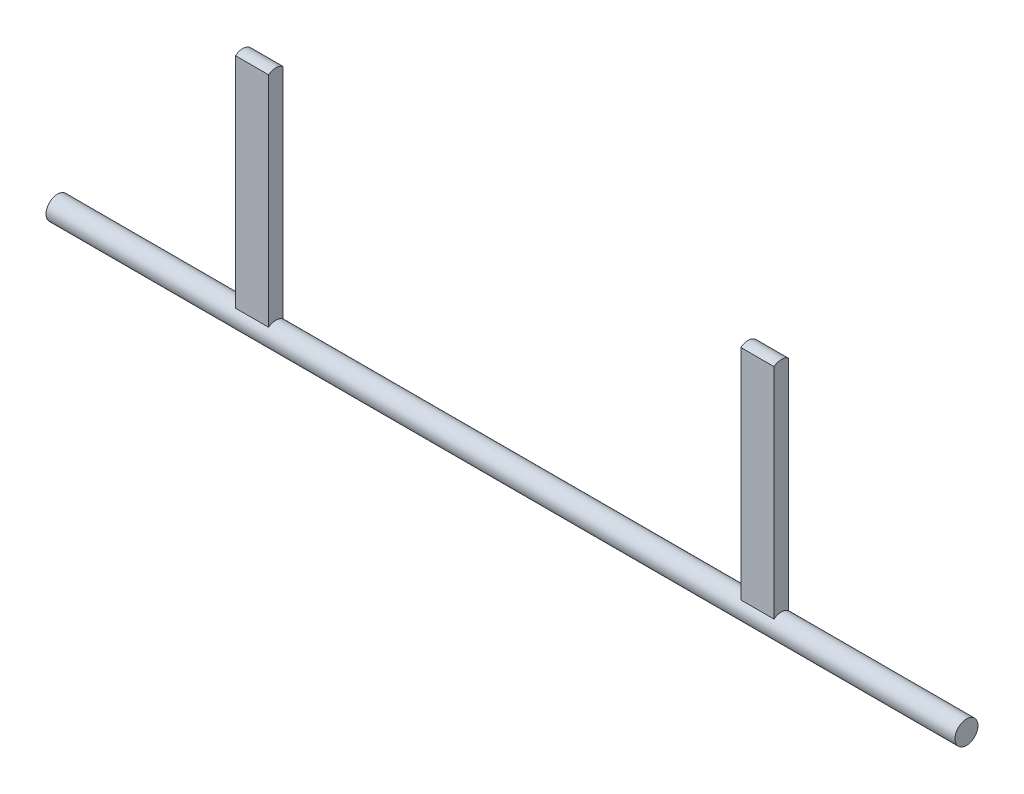
from build123d import *

# Parameters (mm, degrees)
SKETCH1_W           = 1480
SKETCH1_H           = 18.75
BOSS_EXTRUDE2_START = -438.446590399
BOSS_EXTRUDE2_DEPTH = 54.021923435


# Read off the part's stored shape, not the designer's step: Boss-Extrude2
with BuildPart() as part:
    # Sketch1 → Revolve1 (revolve)
    with BuildSketch(Plane(origin=(0, 0, 0), x_dir=(1, 0, 0), z_dir=(0, 1, 0))):
        with Locations((0, 9.375)):
            Rectangle(SKETCH1_W, SKETCH1_H)
    revolve(axis=Axis((270.12195122, 0, 0), (-1, 0, 0)))

    # Boss-Extrude2 outline → Boss-Extrude2 (add)
    with BuildSketch(Plane.YZ.offset(BOSS_EXTRUDE2_START)):
        with BuildLine():
            Line((14.573043819, -11.797834286), (370.573043819, -11.797834286))
            ThreePointArc((370.573043819, -11.797834286), (374.75, 0), (370.573043819, 11.797834286))
            Line((370.573043819, 11.797834286), (14.573043819, 11.797834286))
            ThreePointArc((14.573043819, 11.797834286), (18.75, 0), (14.573043819, -11.797834286))
        make_face()
    boss_extrude2 = extrude(amount=BOSS_EXTRUDE2_DEPTH)

    # Mirror1: Boss-Extrude2 across plane
    add(boss_extrude2.mirror(Plane(origin=(0, 0, 0), x_dir=(0, 0, 1), z_dir=(1, 0, 0))))


solid = part.part
